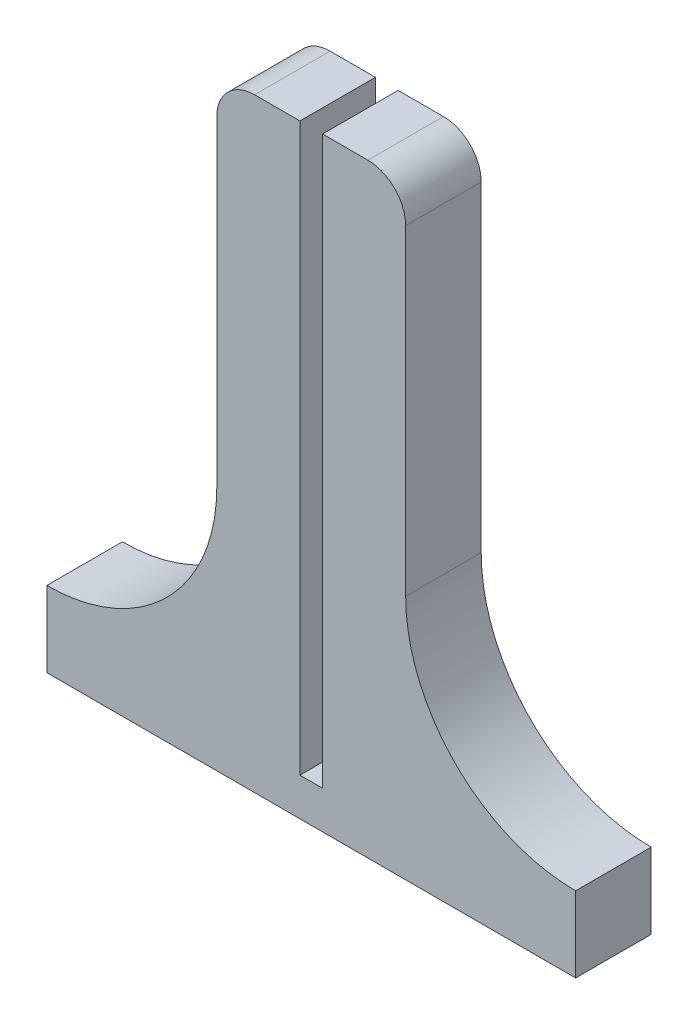
from build123d import *

# Parameters (mm, degrees)
BOSS_EXTRU_1_DEPTH      = 20
CONG_1_R                = 10
ESQUISSE2_W             = 6
ESQUISSE2_H             = 150
ENL_V_MAT_EXTRU_1_DEPTH = 20
ENL_V_MAT_EXTRU_2_DEPTH = 0.6


with BuildPart() as part:
    # Esquisse1 → Boss.-Extru.1 (new body)
    with BuildSketch(Plane.XY):
        with BuildLine():
            Line((-70, 0), (70, 0))
            Line((70, 0), (70, 20))
            ThreePointArc((70, 20), (38.180194847, 33.180194847), (25, 65))
            Line((25, 65), (25, 160))
            Line((25, 160), (-25, 160))
            Line((-25, 160), (-25, 65))
            ThreePointArc((-25, 65), (-38.180194847, 33.180194847), (-70, 20))
            Line((-70, 20), (-70, 0))
        make_face()
    extrude(amount=BOSS_EXTRU_1_DEPTH)

    # Congé1
    cong_1_edges = [part.edges().sort_by_distance(p)[0] for p in [
        (-25, 160, 10),
        (25, 160, 10),
    ]]
    fillet(cong_1_edges, radius=CONG_1_R)

    # Esquisse2 → Enlèv. mat.-Extru.1 (cut)
    with BuildSketch(Plane.XY.offset(20)):
        with Locations((0, 85)):
            Rectangle(ESQUISSE2_W, ESQUISSE2_H)
    extrude(amount=-ENL_V_MAT_EXTRU_1_DEPTH, mode=Mode.SUBTRACT)

    # Esquisse3 → Enlèv. mat.-Extru.2 (cut)
    # profile 1 of 8: a face of its own
    with BuildSketch(Plane.ZY.offset(25)):
        with BuildLine():
            add(Edge.make_bspline(
                [(10.298264208, 116.00253619), (10.269097337, 115.992326869), (10.217774636, 115.974362311), (10.146223156, 115.960911494), (10.087850074, 115.966864128), (10.042769968, 115.997389601), (10.018320339, 116.051964444), (10.004954592, 116.125720815), (10.002334597, 116.224587194), (10.000840513, 116.299040881), (10, 116.340925628)],
                knots=[0, 0, 0, 0, 1.205802245, 2.121757528, 2.825936218, 3.439242086, 4.14792585, 5.090303633, 6.363118044, 8, 8, 8, 8], degree=3))
            add(Edge.make_bspline(
                [(10, 116.340925628), (10.000114375, 116.382830885), (10.000317702, 116.45732656), (10.004773603, 116.556579531), (10.01453085, 116.631507153), (10.02464009, 116.687809902), (10.043786522, 116.728119067), (10.070404737, 116.755826472), (10.102576181, 116.775404191), (10.125641709, 116.786940542), (10.137763289, 116.793003217)],
                knots=[0, 0, 0, 0, 1.984758632, 3.528338574, 4.698935026, 5.564578638, 6.225528186, 6.778115051, 7.357865301, 8, 8, 8, 8], degree=3))
            Line((10.137763289, 116.793003217), (11.540808824, 117.293231081))
            Line((11.540808824, 117.293231081), (11.540808824, 119.722144991))
            Line((11.540808824, 119.722144991), (10.156488396, 120.200972733))
            add(Edge.make_bspline(
                [(10.156488396, 120.200972733), (10.143862376, 120.205976287), (10.119506065, 120.215628427), (10.085507972, 120.235820612), (10.058092353, 120.265723983), (10.033968103, 120.305141208), (10.017547599, 120.359621157), (10.005565685, 120.430956204), (10.002174093, 120.522853414), (10.00077614, 120.591090262), (10, 120.628975184)],
                knots=[0, 0, 0, 0, 0.663060064, 1.27908053, 1.910294906, 2.623277198, 3.518069493, 4.666729453, 6.149376829, 8, 8, 8, 8], degree=3))
            add(Edge.make_bspline(
                [(10, 120.628975184), (10.000510946, 120.66864451), (10.00143085, 120.740064936), (10.007654826, 120.836367622), (10.023164734, 120.908664456), (10.048583816, 120.962231124), (10.093140982, 120.990826296), (10.15073614, 120.995142921), (10.221785969, 120.982308262), (10.273109429, 120.964251351), (10.302276731, 120.953989545)],
                knots=[0, 0, 0, 0, 1.580415266, 2.845370517, 3.831421033, 4.522876749, 5.138370736, 5.836404331, 6.770420993, 8, 8, 8, 8], degree=3))
            Line((10.302276731, 120.953989545), (15.665682445, 118.995878332))
            add(Edge.make_bspline(
                [(15.665682445, 118.995878332), (15.680224312, 118.989272066), (15.708098977, 118.976608806), (15.745112383, 118.949084074), (15.773356627, 118.910133289), (15.792627136, 118.858485618), (15.806954153, 118.793229828), (15.815447144, 118.711183525), (15.820619559, 118.609856356), (15.820757428, 118.53533922), (15.820833333, 118.49431296)],
                knots=[0, 0, 0, 0, 0.683309499, 1.30980594, 1.951546434, 2.714075901, 3.654596571, 4.80831387, 6.242780742, 8, 8, 8, 8], degree=3))
            add(Edge.make_bspline(
                [(15.820833333, 118.49431296), (15.820751345, 118.450170997), (15.820603023, 118.370316023), (15.815545051, 118.261812307), (15.806709356, 118.174582224), (15.793508021, 118.105178335), (15.771516131, 118.051537529), (15.742893381, 118.010273306), (15.7043801, 117.981144433), (15.675352025, 117.968518025), (15.660332414, 117.961984911)],
                knots=[0, 0, 0, 0, 1.785583793, 3.230208585, 4.391350102, 5.332300968, 6.075914607, 6.721668301, 7.338569788, 8, 8, 8, 8], degree=3))
            Line((15.660332414, 117.961984911), (10.298264208, 116.00253619))
        make_face()
        Polygon((15.050428922, 118.51705059), (15.050428922, 118.521063113), (12.140012255, 119.52820638), (12.140012255, 117.496532246), align=None, mode=Mode.SUBTRACT)
    # profile 2 of 8: a face of its own
    with BuildSketch(Plane.ZY.offset(25)):
        with BuildLine():
            add(Edge.make_bspline(
                [(10.137763289, 114.305238971), (10.126952741, 114.306440051), (10.105807787, 114.308789312), (10.075590027, 114.322520282), (10.052152964, 114.34960007), (10.031346744, 114.386960575), (10.01867842, 114.439438389), (10.005169697, 114.506555801), (10.002316192, 114.59327153), (10.000826824, 114.657474067), (10, 114.693116192)],
                knots=[0, 0, 0, 0, 0.57799335, 1.130529403, 1.718684988, 2.452414818, 3.392179586, 4.57566491, 6.098975781, 8, 8, 8, 8], degree=3))
            add(Edge.make_bspline(
                [(10, 114.693116192), (10.000788929, 114.727430941), (10.002214206, 114.789423857), (10.005533098, 114.874244869), (10.018513727, 114.941543918), (10.031979891, 114.995265081), (10.050944416, 115.034754777), (10.075826673, 115.061160417), (10.105990396, 115.073434551), (10.12697314, 115.074893258), (10.137763289, 115.075643382)],
                knots=[0, 0, 0, 0, 1.843799585, 3.331002373, 4.54710588, 5.517086629, 6.298633703, 6.874127249, 7.421032119, 8, 8, 8, 8], degree=3))
            Line((10.137763289, 115.075643382), (14.142261221, 115.075643382))
            add(Edge.make_bspline(
                [(14.142261221, 115.075643382), (14.153100676, 115.074988992), (14.173768968, 115.073741223), (14.203196443, 115.060372601), (14.229274794, 115.035150123), (14.248947591, 114.995108055), (14.267208843, 114.942366519), (14.274209332, 114.873798524), (14.279977411, 114.789543787), (14.28000773, 114.727471176), (14.28002451, 114.693116192)],
                knots=[0, 0, 0, 0, 0.578058868, 1.102222245, 1.693953314, 2.485538118, 3.468049268, 4.674692977, 6.15956077, 8, 8, 8, 8], degree=3))
            add(Edge.make_bspline(
                [(14.28002451, 114.693116192), (14.279987354, 114.657430062), (14.279920417, 114.593141559), (14.274485048, 114.507027011), (14.267034375, 114.438605055), (14.249618683, 114.387078279), (14.22805071, 114.349271182), (14.203376024, 114.323332935), (14.173976891, 114.30846141), (14.153126405, 114.306342917), (14.142261221, 114.305238971)],
                knots=[0, 0, 0, 0, 1.897439217, 3.418233642, 4.592122555, 5.544614129, 6.288938217, 6.892652516, 7.422961471, 8, 8, 8, 8], degree=3))
            Line((14.142261221, 114.305238971), (10.137763289, 114.305238971))
        make_face()
    # profile 3 of 8: a face of its own
    with BuildSketch(Plane.ZY.offset(25)):
        with BuildLine():
            add(Edge.make_bspline(
                [(15.482443896, 114.904442402), (15.444864984, 114.90497412), (15.374947984, 114.905963402), (15.280152438, 114.925297195), (15.201582572, 114.951540877), (15.141020965, 114.995603849), (15.097897588, 115.056740729), (15.07119576, 115.13545123), (15.051978121, 115.230315707), (15.050970498, 115.300221823), (15.050428922, 115.337794884)],
                knots=[0, 0, 0, 0, 1.251063579, 2.327651597, 3.217401041, 3.99399053, 4.782598959, 5.672348403, 6.748936421, 8, 8, 8, 8], degree=3))
            add(Edge.make_bspline(
                [(15.050428922, 115.337794884), (15.051042843, 115.375350428), (15.052169349, 115.444262387), (15.07001531, 115.537842549), (15.095166142, 115.613961669), (15.135593008, 115.674019365), (15.195496519, 115.713766754), (15.270349855, 115.741646957), (15.363585716, 115.758385572), (15.431991775, 115.75972261), (15.469068819, 115.760447304)],
                knots=[0, 0, 0, 0, 1.282619219, 2.353522076, 3.246122122, 4.012069897, 4.778017671, 5.661712447, 6.732615304, 8, 8, 8, 8], degree=3))
            add(Edge.make_bspline(
                [(15.469068819, 115.760447304), (15.507481007, 115.759692066), (15.57853694, 115.758295007), (15.675854588, 115.741758824), (15.754269606, 115.713153879), (15.815387889, 115.671002169), (15.85937987, 115.611497135), (15.887461278, 115.534260122), (15.904379597, 115.439291858), (15.905712187, 115.369979507), (15.906433824, 115.332444853)],
                knots=[0, 0, 0, 0, 1.278224906, 2.364495922, 3.271623907, 4.037937767, 4.801080858, 5.694373703, 6.751436324, 8, 8, 8, 8], degree=3))
            add(Edge.make_bspline(
                [(15.906433824, 115.332444853), (15.905746572, 115.294903577), (15.904477479, 115.225578998), (15.887188017, 115.130845605), (15.86034961, 115.053432876), (15.818635727, 114.992794954), (15.758906922, 114.950494476), (15.68232171, 114.923479461), (15.588403853, 114.906519168), (15.519534335, 114.905169357), (15.482443896, 114.904442402)],
                knots=[0, 0, 0, 0, 1.267726145, 2.341012151, 3.242611919, 4.020686865, 4.786544989, 5.674045477, 6.747331483, 8, 8, 8, 8], degree=3))
        make_face()
    # profile 4 of 8: a face of its own
    with BuildSketch(Plane.ZY.offset(25)):
        with BuildLine():
            add(Edge.make_bspline(
                [(15.482443896, 113.449234069), (15.444864984, 113.449765787), (15.374947984, 113.450755069), (15.280152438, 113.470088862), (15.201582572, 113.496332543), (15.141020965, 113.540395515), (15.097897588, 113.601532395), (15.07119576, 113.680242896), (15.051978121, 113.775107374), (15.050970498, 113.845013489), (15.050428922, 113.88258655)],
                knots=[0, 0, 0, 0, 1.251063579, 2.327651597, 3.217401041, 3.99399053, 4.782598959, 5.672348403, 6.748936421, 8, 8, 8, 8], degree=3))
            add(Edge.make_bspline(
                [(15.050428922, 113.88258655), (15.051042843, 113.920142095), (15.052169349, 113.989054054), (15.07001531, 114.082634216), (15.095166142, 114.158753336), (15.135593008, 114.218811032), (15.195496519, 114.258558421), (15.270349855, 114.286438624), (15.363585716, 114.303177238), (15.431991775, 114.304514277), (15.469068819, 114.305238971)],
                knots=[0, 0, 0, 0, 1.282619219, 2.353522076, 3.246122122, 4.012069897, 4.778017671, 5.661712447, 6.732615304, 8, 8, 8, 8], degree=3))
            add(Edge.make_bspline(
                [(15.469068819, 114.305238971), (15.507480723, 114.304483612), (15.578536131, 114.303086328), (15.675857083, 114.286551557), (15.75426241, 114.257942471), (15.815410243, 114.21580339), (15.85904033, 114.156589791), (15.887356633, 114.08087932), (15.904497657, 113.987675081), (15.905750426, 113.919679053), (15.906433824, 113.88258655)],
                knots=[0, 0, 0, 0, 1.287529354, 2.381707548, 3.295438694, 4.067330701, 4.836028859, 5.721921549, 6.757285759, 8, 8, 8, 8], degree=3))
            add(Edge.make_bspline(
                [(15.906433824, 113.88258655), (15.905777513, 113.844148176), (15.904570951, 113.773483077), (15.887088424, 113.67705046), (15.86068409, 113.598539584), (15.818612961, 113.537595226), (15.758914017, 113.495283461), (15.682319241, 113.468272061), (15.588404648, 113.451310534), (15.519534614, 113.449960919), (15.482443896, 113.449234069)],
                knots=[0, 0, 0, 0, 1.288329615, 2.368464882, 3.27748285, 4.049854626, 4.810099126, 5.69109437, 6.756513352, 8, 8, 8, 8], degree=3))
        make_face()
    # profile 5 of 8: a face of its own
    with BuildSketch(Plane.ZY.offset(25)):
        with BuildLine():
            add(Edge.make_bspline(
                [(12.295163143, 109.426011029), (12.267907447, 109.426947638), (12.216857846, 109.428701896), (12.145758019, 109.443741511), (12.088029732, 109.472661135), (12.042032764, 109.510528174), (12.011185902, 109.557494869), (11.985689828, 109.60534849), (11.972530905, 109.657632034), (11.970060534, 109.693009755), (11.968811275, 109.710900161)],
                knots=[0, 0, 0, 0, 1.335857227, 2.502045011, 3.528175974, 4.473906449, 5.383343072, 6.262883897, 7.121545699, 8, 8, 8, 8], degree=3))
            Line((11.968811275, 109.710900161), (11.968811275, 112.336427696))
            add(Edge.make_bspline(
                [(11.968811275, 112.336427696), (11.914399597, 112.335675361), (11.808556941, 112.334211905), (11.653481631, 112.322310073), (11.507008251, 112.300871807), (11.368645965, 112.271985648), (11.239466638, 112.233398202), (11.119292521, 112.184116643), (11.009201712, 112.122029714), (10.908363832, 112.049779916), (10.817107913, 111.966109096), (10.738576645, 111.869012352), (10.669739472, 111.760988947), (10.611688096, 111.641502327), (10.567739016, 111.508291514), (10.535853566, 111.362218198), (10.517464709, 111.202241204), (10.514921785, 111.091255885), (10.513602941, 111.033695236)],
                knots=[0, 0, 0, 0, 1.162947511, 2.262188155, 3.321461316, 4.325137283, 5.28079692, 6.199292087, 7.095265559, 7.975956197, 8.845856955, 9.73291758, 10.637013272, 11.578938221, 12.564352389, 13.627946076, 14.769774549, 16, 16, 16, 16], degree=3))
            add(Edge.make_bspline(
                [(10.513602941, 111.033695236), (10.513800845, 110.987296925), (10.514183925, 110.897484363), (10.526135339, 110.766802361), (10.541089055, 110.643807458), (10.571341734, 110.494681598), (10.617109769, 110.327080018), (10.679127929, 110.149631539), (10.743769883, 110.003142849), (10.796377529, 109.884546936), (10.844080672, 109.795758508), (10.852556206, 109.740196061), (10.856004902, 109.717587699)],
                knots=[0, 0, 0, 0, 1.01347145, 1.961762513, 2.865722105, 3.719843941, 5.284486502, 6.658853132, 7.824326974, 8.779052951, 9.503196596, 10, 10, 10, 10], degree=3))
            add(Edge.make_bspline(
                [(10.856004902, 109.717587699), (10.85525752, 109.707644375), (10.853771909, 109.687879486), (10.841206037, 109.660963629), (10.821469304, 109.637618619), (10.791286215, 109.622066765), (10.752471041, 109.609904542), (10.702367706, 109.603044318), (10.640357119, 109.59729763), (10.594767264, 109.597242324), (10.569778263, 109.59721201)],
                knots=[0, 0, 0, 0, 0.686729454, 1.365049659, 2.022603672, 2.770670072, 3.680311579, 4.839623702, 6.267714482, 8, 8, 8, 8], degree=3))
            add(Edge.make_bspline(
                [(10.569778263, 109.59721201), (10.551946828, 109.597591463), (10.518492316, 109.598303375), (10.47152045, 109.600285917), (10.430548176, 109.606216175), (10.394179233, 109.612436835), (10.36157064, 109.621504073), (10.331991032, 109.635324997), (10.306175037, 109.654828734), (10.282092858, 109.672925032), (10.263408262, 109.697957154), (10.244853866, 109.729608512), (10.22161801, 109.773336712), (10.178353861, 109.851181111), (10.127168962, 109.976012971), (10.065204935, 110.152307677), (10.009219881, 110.363008798), (9.958570297, 110.602729633), (9.920487255, 110.866695606), (9.91646252, 111.050495646), (9.91439951, 111.144708372)],
                knots=[0, 0, 0, 0, 0.523723728, 0.982586185, 1.378731315, 1.738143054, 2.065368142, 2.369810598, 2.689353897, 3.014478, 3.247521083, 3.599953288, 4.091967521, 4.700993102, 6.213438645, 8.043092203, 10.186374065, 12.607132101, 15.235709053, 18, 18, 18, 18], degree=3))
            add(Edge.make_bspline(
                [(9.91439951, 111.144708372), (9.91638233, 111.226347584), (9.92023875, 111.385129062), (9.944655805, 111.615454988), (9.989788218, 111.82949561), (10.048389302, 112.028955847), (10.12911499, 112.21185356), (10.222624563, 112.381602309), (10.337368019, 112.53369645), (10.465595834, 112.672861088), (10.612864486, 112.795181561), (10.777303394, 112.901331926), (10.959182186, 112.991053501), (11.158305419, 113.064462021), (11.374658359, 113.121723471), (11.608227466, 113.16246028), (11.858544913, 113.188537691), (12.031160515, 113.191109648), (12.11994964, 113.192432598)],
                knots=[0, 0, 0, 0, 1.138312715, 2.213923543, 3.223288148, 4.184801417, 5.106262952, 6.005227789, 6.880412264, 7.755596738, 8.638188383, 9.541611846, 10.478396608, 11.459795211, 12.495607232, 13.594177056, 14.762505165, 16, 16, 16, 16], degree=3))
            add(Edge.make_bspline(
                [(12.11994964, 113.192432598), (12.204727247, 113.191081829), (12.37022644, 113.188444915), (12.612156171, 113.162334556), (12.840943919, 113.120411618), (13.056162214, 113.059923826), (13.256361416, 112.983622524), (13.443411775, 112.894433583), (13.612747004, 112.787093882), (13.767028533, 112.666129303), (13.903758047, 112.530121507), (14.025498183, 112.381082084), (14.128228477, 112.217097921), (14.214099247, 112.0408566), (14.282949083, 111.853302294), (14.330244129, 111.653935337), (14.360943881, 111.444373846), (14.364043412, 111.300862803), (14.365625, 111.227633847)],
                knots=[0, 0, 0, 0, 1.206949826, 2.356155476, 3.460715998, 4.516002349, 5.534826805, 6.508824267, 7.461818199, 8.384005709, 9.295398287, 10.202712429, 11.118693544, 12.044393332, 12.990424503, 13.957506214, 14.957782715, 16, 16, 16, 16], degree=3))
            add(Edge.make_bspline(
                [(14.365625, 111.227633847), (14.36413248, 111.149942936), (14.361255734, 111.000198224), (14.330750997, 110.784800258), (14.284335776, 110.586701434), (14.214390198, 110.407787782), (14.131479226, 110.244328144), (14.033546255, 110.097075415), (13.922618452, 109.963993944), (13.798329619, 109.846265723), (13.660853272, 109.744369144), (13.512322767, 109.656821694), (13.352867777, 109.583223786), (13.18254065, 109.524345579), (13.003504556, 109.481518154), (12.818225456, 109.44875662), (12.626799801, 109.430159793), (12.497164695, 109.427404693), (12.431588925, 109.426011029)],
                knots=[0, 0, 0, 0, 1.242451977, 2.394753943, 3.474556508, 4.490852541, 5.460890958, 6.402814045, 7.31450092, 8.228000656, 9.135546277, 10.047149394, 10.982483155, 11.941438071, 12.926060434, 13.925435957, 14.95058415, 16, 16, 16, 16], degree=3))
            Line((12.431588925, 109.426011029), (12.295163143, 109.426011029))
        make_face()
        with BuildLine():
            add(Edge.make_bspline(
                [(12.482414216, 110.196415441), (12.531018437, 110.196304615), (12.625655426, 110.196088825), (12.763857224, 110.205028113), (12.894201906, 110.224340943), (13.01680672, 110.249670581), (13.130470878, 110.287036267), (13.236778829, 110.33035765), (13.334490566, 110.384510528), (13.425075572, 110.445615915), (13.504882091, 110.516765197), (13.575998123, 110.594940329), (13.634821343, 110.682615941), (13.682924577, 110.777981399), (13.721041532, 110.881102693), (13.747051665, 110.992072512), (13.763688977, 111.111215197), (13.765490234, 111.193245426), (13.766421569, 111.235658892)],
                knots=[0, 0, 0, 0, 1.23774357, 2.410003075, 3.522847847, 4.591904643, 5.593783504, 6.565943827, 7.511138326, 8.433969626, 9.343005538, 10.227527643, 11.118802201, 12.022717545, 12.942399837, 13.911837482, 14.92032228, 16, 16, 16, 16], degree=3))
            add(Edge.make_bspline(
                [(13.766421569, 111.235658892), (13.765198304, 111.27898316), (13.762813496, 111.363445694), (13.742546762, 111.485696501), (13.70876393, 111.599777618), (13.662171493, 111.705331458), (13.603182488, 111.801778684), (13.539042617, 111.892291699), (13.462134345, 111.971266878), (13.379437206, 112.043993531), (13.287924301, 112.108512814), (13.188323525, 112.164022393), (13.082645531, 112.214757632), (12.93017424, 112.266353778), (12.730771119, 112.318950187), (12.565736164, 112.330564118), (12.482414216, 112.336427696)],
                knots=[0, 0, 0, 0, 0.964495249, 1.880325208, 2.750609288, 3.608626796, 4.441391799, 5.265647136, 6.073407844, 6.889850158, 7.716375352, 8.561306733, 9.427559201, 10.322643299, 12.143396204, 14, 14, 14, 14], degree=3))
            Line((12.482414216, 112.336427696), (12.482414216, 110.196415441))
        make_face(mode=Mode.SUBTRACT)
    # profile 6 of 8: a face of its own
    with BuildSketch(Plane.ZY.offset(25)):
        with BuildLine():
            add(Edge.make_bspline(
                [(10.345076976, 103.177175245), (10.317000076, 103.177956538), (10.26524768, 103.179396647), (10.193775132, 103.182931754), (10.134591551, 103.195525879), (10.085769193, 103.212028557), (10.047624521, 103.234975624), (10.01854723, 103.261914966), (10.003103851, 103.296652865), (10.001058104, 103.321046651), (10, 103.333663641)],
                knots=[0, 0, 0, 0, 1.605313513, 2.958974165, 4.077843145, 5.052651833, 5.886909949, 6.607263286, 7.279646663, 8, 8, 8, 8], degree=3))
            Line((10, 103.333663641), (10, 105.886965763))
            add(Edge.make_bspline(
                [(10, 105.886965763), (10.003536552, 105.92100722), (10.010796097, 105.990884735), (10.05650501, 106.070315548), (10.110312551, 106.124438375), (10.167185469, 106.153632745), (10.236145728, 106.171130851), (10.286104631, 106.172471361), (10.312976792, 106.173192402)],
                knots=[0, 0, 0, 0, 1.276746539, 2.620800728, 3.344384187, 4.124832945, 4.991375171, 6, 6, 6, 6], degree=3))
            Line((10.312976792, 106.173192402), (15.677720014, 106.173192402))
            add(Edge.make_bspline(
                [(15.677720014, 106.173192402), (15.689023202, 106.17209402), (15.711307587, 106.169928546), (15.742781873, 106.154303145), (15.768860774, 106.124764877), (15.784104611, 106.078986859), (15.79899446, 106.019613199), (15.809880164, 105.943369105), (15.820346784, 105.85023515), (15.820661732, 105.782238359), (15.820833333, 105.745189951)],
                knots=[0, 0, 0, 0, 0.55219088, 1.088651567, 1.675504795, 2.428826423, 3.418011055, 4.676595417, 6.189225567, 8, 8, 8, 8], degree=3))
            add(Edge.make_bspline(
                [(15.820833333, 105.745189951), (15.820642524, 105.707256606), (15.820293837, 105.637936914), (15.810280107, 105.544260201), (15.798759146, 105.469062327), (15.784401262, 105.411174422), (15.768039609, 105.366641961), (15.743291519, 105.336067331), (15.711257974, 105.320491248), (15.689006506, 105.318299307), (15.677720014, 105.3171875)],
                knots=[0, 0, 0, 0, 1.855003094, 3.389847137, 4.605770636, 5.574134644, 6.307541132, 6.910984118, 7.447624331, 8, 8, 8, 8], degree=3))
            Line((15.677720014, 105.3171875), (10.684803922, 105.3171875))
            Line((10.684803922, 105.3171875), (10.684803922, 103.326976103))
            add(Edge.make_bspline(
                [(10.684803922, 103.326976103), (10.683906626, 103.314703221), (10.682156495, 103.290765577), (10.664462281, 103.259065487), (10.638945237, 103.232111236), (10.602922544, 103.210734794), (10.55551668, 103.195231414), (10.496790857, 103.183056829), (10.42491444, 103.179362967), (10.373156749, 103.177944692), (10.345076976, 103.177175245)],
                knots=[0, 0, 0, 0, 0.711060461, 1.386888063, 2.068714254, 2.864024082, 3.803314885, 4.97330271, 6.357945089, 8, 8, 8, 8], degree=3))
        make_face()
    # profile 7 of 8: a face of its own
    with BuildSketch(Plane.ZY.offset(25)):
        with BuildLine():
            add(Edge.make_bspline(
                [(10.133750766, 99.325153186), (10.117499868, 99.326553216), (10.086383753, 99.329233897), (10.049341677, 99.362577538), (10.028311647, 99.410039503), (10.00951912, 99.471876554), (10.002560398, 99.556885748), (10.000934697, 99.621209577), (10, 99.658192593)],
                knots=[0, 0, 0, 0, 0.724001117, 1.386268131, 2.139240658, 3.069878209, 4.315325055, 6, 6, 6, 6], degree=3))
            add(Edge.make_bspline(
                [(10, 99.658192593), (10.000909497, 99.695183669), (10.00251313, 99.760406658), (10.009972006, 99.847514115), (10.027422764, 99.911366001), (10.049025137, 99.960014596), (10.08840417, 99.98930887), (10.1190282, 99.991447797), (10.135088274, 99.992569508)],
                knots=[0, 0, 0, 0, 1.665775782, 2.937110524, 3.915160111, 4.641913912, 5.287782743, 6, 6, 6, 6], degree=3))
            Line((10.135088274, 99.992569508), (10.541690602, 99.992569508))
            add(Edge.make_bspline(
                [(10.541690602, 99.992569508), (10.495897809, 100.036864691), (10.405072698, 100.124719452), (10.283271821, 100.268410027), (10.176159904, 100.419853721), (10.083267964, 100.577692324), (10.007380833, 100.742027054), (9.954065325, 100.912838845), (9.920375564, 101.088446581), (9.916401679, 101.207321408), (9.91439951, 101.267214308)],
                knots=[0, 0, 0, 0, 1.04528672, 2.073214502, 3.086422922, 4.086758263, 5.075786975, 6.050195739, 7.017626916, 8, 8, 8, 8], degree=3))
            add(Edge.make_bspline(
                [(9.91439951, 101.267214308), (9.915360016, 101.318979135), (9.917244433, 101.42053657), (9.933916385, 101.568434669), (9.958770938, 101.709057671), (9.995249389, 101.841306575), (10.039927583, 101.96633699), (10.09645303, 102.081049106), (10.160842186, 102.186722498), (10.234936635, 102.282172152), (10.317844947, 102.36849119), (10.411146874, 102.443202853), (10.51180144, 102.509751141), (10.622090958, 102.564181662), (10.740593243, 102.6089689), (10.867562616, 102.640722636), (11.002563505, 102.659637652), (11.094911125, 102.662239219), (11.142231541, 102.663572304)],
                knots=[0, 0, 0, 0, 1.182508077, 2.319963066, 3.397049868, 4.442497454, 5.451313259, 6.426383306, 7.359459888, 8.274451657, 9.182268696, 10.087624203, 11.000344391, 11.934366029, 12.89187355, 13.890139628, 14.918873387, 16, 16, 16, 16], degree=3))
            add(Edge.make_bspline(
                [(11.142231541, 102.663572304), (11.197204299, 102.66238753), (11.304283877, 102.660079749), (11.458546266, 102.631913965), (11.602736212, 102.59017851), (11.734051929, 102.527179742), (11.856033261, 102.450861886), (11.966095099, 102.3574877), (12.065692549, 102.249638577), (12.154393656, 102.126946676), (12.23163765, 101.989188214), (12.300525564, 101.837909522), (12.355589863, 101.670679666), (12.402482611, 101.490698724), (12.437835007, 101.297031902), (12.465038532, 101.091776165), (12.479053921, 100.874183248), (12.481274858, 100.72554055), (12.482414216, 100.649285769)],
                knots=[0, 0, 0, 0, 0.965443146, 1.880554095, 2.748616068, 3.597345577, 4.432533671, 5.272711072, 6.12707045, 7.008377997, 7.928278645, 8.900225302, 9.92661174, 11.019977072, 12.168582707, 13.38605233, 14.659025893, 16, 16, 16, 16], degree=3))
            Line((12.482414216, 100.649285769), (12.482414216, 100.095557598))
            Line((12.482414216, 100.095557598), (12.800741039, 100.095557598))
            add(Edge.make_bspline(
                [(12.800741039, 100.095557598), (12.875415585, 100.097319938), (13.016467878, 100.10064881), (13.18557477, 100.134073572), (13.30698104, 100.170050909), (13.385927587, 100.20939981), (13.459778752, 100.251134174), (13.524264189, 100.304094664), (13.580349059, 100.365088831), (13.631293901, 100.432366258), (13.671574311, 100.509328771), (13.707834303, 100.593370663), (13.73327889, 100.68762342), (13.754253241, 100.791128017), (13.763786637, 100.905021202), (13.765521508, 100.984099258), (13.766421569, 101.025125421)],
                knots=[0, 0, 0, 0, 2.019084218, 3.813835772, 4.650002842, 5.438441153, 6.196244138, 6.942905917, 7.686045687, 8.436989712, 9.220327809, 10.03199393, 10.910907431, 11.857988045, 12.888711541, 14, 14, 14, 14], degree=3))
            add(Edge.make_bspline(
                [(13.766421569, 101.025125421), (13.765663343, 101.069734641), (13.764181904, 101.156893229), (13.752271143, 101.284380474), (13.731177843, 101.404733502), (13.691436583, 101.5514648), (13.636050132, 101.718685705), (13.556696724, 101.895835407), (13.482431302, 102.047645139), (13.419526462, 102.154560643), (13.376117406, 102.226595203), (13.357235982, 102.272590708), (13.34124856, 102.309889731), (13.339281268, 102.333542384), (13.338419118, 102.343907973)],
                knots=[0, 0, 0, 0, 1.143534929, 2.234266574, 3.279115031, 4.271636165, 6.129528302, 7.788011536, 9.244858549, 10.458453731, 10.970266691, 11.395033847, 11.734878329, 12, 12, 12, 12], degree=3))
            add(Edge.make_bspline(
                [(13.338419118, 102.343907973), (13.339605797, 102.35517395), (13.341925165, 102.377193338), (13.355925818, 102.408754956), (13.381429227, 102.433958361), (13.4154436, 102.456133285), (13.459009408, 102.474980387), (13.5138067, 102.483905141), (13.57586596, 102.490807356), (13.620159541, 102.491833559), (13.643370864, 102.492371324)],
                knots=[0, 0, 0, 0, 0.722226339, 1.411593723, 2.158196488, 2.981018633, 4.003595283, 5.16724152, 6.515539527, 8, 8, 8, 8], degree=3))
            add(Edge.make_bspline(
                [(13.643370864, 102.492371324), (13.678619999, 102.491700383), (13.741361652, 102.490506142), (13.828157635, 102.480045087), (13.903493282, 102.452401165), (13.954888143, 102.407163992), (13.997022102, 102.361116258), (14.027831305, 102.31151224), (14.063206547, 102.253464592), (14.109997414, 102.15664055), (14.17015264, 102.019646647), (14.22961154, 101.834543825), (14.285331192, 101.630530488), (14.327554847, 101.409672397), (14.361223841, 101.179035744), (14.364156208, 101.022129933), (14.365625, 100.943537454)],
                knots=[0, 0, 0, 0, 0.789429819, 1.405144594, 1.952168764, 2.555698058, 2.916425161, 3.348467631, 3.858808214, 4.439347839, 5.754453571, 7.207004439, 8.788703472, 10.48854221, 12.241147528, 14, 14, 14, 14], degree=3))
            add(Edge.make_bspline(
                [(14.365625, 100.943537454), (14.364124889, 100.872628844), (14.361233157, 100.735939879), (14.345286742, 100.538465714), (14.312473984, 100.358059004), (14.27063192, 100.193377129), (14.215342529, 100.045225642), (14.149635664, 99.911308844), (14.072622803, 99.791284188), (13.98135944, 99.687678056), (13.880843409, 99.596355169), (13.766052947, 99.521766878), (13.642201895, 99.456678172), (13.505066787, 99.407655671), (13.357541989, 99.370718206), (13.1983325, 99.344048681), (13.027555782, 99.328038598), (12.909560532, 99.326132987), (12.848891314, 99.325153186)],
                knots=[0, 0, 0, 0, 1.327310201, 2.558626637, 3.702692837, 4.755062866, 5.734555212, 6.65622678, 7.54258946, 8.394223195, 9.23333949, 10.075685238, 10.948912375, 11.846397708, 12.79347634, 13.79207927, 14.864760873, 16, 16, 16, 16], degree=3))
            Line((12.848891314, 99.325153186), (10.133750766, 99.325153186))
        make_face()
        with BuildLine():
            Line((11.968811275, 100.095557598), (11.968811275, 100.720173675))
            add(Edge.make_bspline(
                [(11.968811275, 100.720173675), (11.968615955, 100.768799729), (11.968239116, 100.862616467), (11.956412711, 100.998215786), (11.941498208, 101.12390065), (11.918280216, 101.239471808), (11.890531357, 101.346070197), (11.8563154, 101.443481175), (11.814772465, 101.531495295), (11.766172214, 101.608773592), (11.714174134, 101.678521548), (11.655280176, 101.737047841), (11.591580081, 101.786366968), (11.522630461, 101.824722362), (11.449539645, 101.856805981), (11.37044205, 101.87700566), (11.286323775, 101.891539898), (11.228347295, 101.892613473), (11.198406863, 101.893167892)],
                knots=[0, 0, 0, 0, 1.470403632, 2.836925074, 4.115055408, 5.297440403, 6.39996988, 7.445155629, 8.416455274, 9.337180267, 10.20312658, 11.042402279, 11.840913429, 12.63221569, 13.42386272, 14.248377648, 15.095420588, 16, 16, 16, 16], degree=3))
            add(Edge.make_bspline(
                [(11.198406863, 101.893167892), (11.148627944, 101.891240026), (11.052860972, 101.887531109), (10.917439681, 101.848228123), (10.796690262, 101.786846826), (10.69561774, 101.697490332), (10.612577254, 101.588543766), (10.554902264, 101.457500265), (10.519804812, 101.307830975), (10.515740108, 101.201440025), (10.513602941, 101.145501111)],
                knots=[0, 0, 0, 0, 1.039784666, 2.000385537, 2.92750565, 3.854155501, 4.800907748, 5.774533853, 6.829880164, 8, 8, 8, 8], degree=3))
            add(Edge.make_bspline(
                [(10.513602941, 101.145501111), (10.515324173, 101.09808946), (10.518732747, 101.004199633), (10.548407748, 100.866702553), (10.593677872, 100.734166681), (10.659601984, 100.606231525), (10.746077428, 100.481346315), (10.849606636, 100.353716995), (10.973603041, 100.223754867), (11.065895166, 100.139568673), (11.11414388, 100.095557598)],
                knots=[0, 0, 0, 0, 0.909503217, 1.801099472, 2.689194817, 3.592836078, 4.554556236, 5.601521194, 6.746117092, 8, 8, 8, 8], degree=3))
            Line((11.11414388, 100.095557598), (11.968811275, 100.095557598))
        make_face(mode=Mode.SUBTRACT)
    # profile 8 of 8: a face of its own
    with BuildSketch(Plane.ZY.offset(25)):
        with BuildLine():
            add(Edge.make_bspline(
                [(12.192175054, 94.189123775), (12.106504526, 94.190024141), (11.939299627, 94.191781405), (11.695235445, 94.21663076), (11.463666633, 94.249093255), (11.246574435, 94.300681092), (11.043904911, 94.364650584), (10.85551554, 94.441387981), (10.684040946, 94.534953727), (10.525776369, 94.638165055), (10.386650046, 94.758710546), (10.262336746, 94.889392984), (10.157217146, 95.034716803), (10.068653779, 95.191423889), (9.99762687, 95.361212693), (9.951673147, 95.544406535), (9.918480966, 95.738099955), (9.915782065, 95.871556187), (9.91439951, 95.939921301)],
                knots=[0, 0, 0, 0, 1.266589352, 2.472028043, 3.625703313, 4.723023035, 5.767905653, 6.767240796, 7.726180359, 8.65348765, 9.556175132, 10.442601023, 11.315804603, 12.201666118, 13.100563771, 14.028316483, 14.989973235, 16, 16, 16, 16], degree=3))
            add(Edge.make_bspline(
                [(9.91439951, 95.939921301), (9.9160724, 96.002444642), (9.919293303, 96.122824129), (9.947834305, 96.298878511), (9.999334678, 96.465323305), (10.074754576, 96.626493986), (10.172321736, 96.785222697), (10.293835253, 96.944606192), (10.439994473, 97.108704291), (10.549493716, 97.216552305), (10.607228477, 97.273416437)],
                knots=[0, 0, 0, 0, 0.966379089, 1.860620617, 2.748140033, 3.651924143, 4.604906618, 5.62385767, 6.747151057, 8, 8, 8, 8], degree=3))
            Line((10.607228477, 97.273416437), (10.133750766, 97.273416437))
            add(Edge.make_bspline(
                [(10.133750766, 97.273416437), (10.122960538, 97.274683792), (10.101453237, 97.277209911), (10.070589317, 97.290315299), (10.046513764, 97.317199727), (10.029795048, 97.355089748), (10.017644381, 97.403144742), (10.005860277, 97.462393319), (10.002127636, 97.535538203), (10.000754468, 97.589077162), (10, 97.618493413)],
                knots=[0, 0, 0, 0, 0.639235618, 1.274137385, 1.924611995, 2.711908422, 3.693527118, 4.842626516, 6.265224193, 8, 8, 8, 8], degree=3))
            add(Edge.make_bspline(
                [(10, 97.618493413), (10.000701821, 97.647480449), (10.001988015, 97.700603576), (10.006413978, 97.773992284), (10.016516995, 97.834332911), (10.031719659, 97.88207877), (10.047858249, 97.920049973), (10.075389309, 97.942519551), (10.106222718, 97.953063794), (10.127878484, 97.954698313), (10.139100797, 97.955545343)],
                knots=[0, 0, 0, 0, 1.711305005, 3.136225263, 4.338982, 5.304434936, 6.104784006, 6.721371554, 7.337397291, 8, 8, 8, 8], degree=3))
            Line((10.139100797, 97.955545343), (16.105722465, 97.955545343))
            add(Edge.make_bspline(
                [(16.105722465, 97.955545343), (16.11696024, 97.954795268), (16.13880666, 97.953337109), (16.170134614, 97.94111261), (16.19676647, 97.915228326), (16.215031061, 97.874836456), (16.231340658, 97.821918011), (16.240773574, 97.753835535), (16.247498188, 97.669462522), (16.248359354, 97.607370107), (16.248835784, 97.573018153)],
                knots=[0, 0, 0, 0, 0.59768484, 1.161909203, 1.749612123, 2.524620174, 3.493198463, 4.695149072, 6.171627058, 8, 8, 8, 8], degree=3))
            add(Edge.make_bspline(
                [(16.248835784, 97.573018153), (16.248333718, 97.537336755), (16.2474289, 97.473032203), (16.241109562, 97.386780618), (16.231165352, 97.318861476), (16.215691421, 97.267182811), (16.195544646, 97.228968727), (16.1703775, 97.202358281), (16.138980193, 97.188687451), (16.116979087, 97.186341309), (16.105722465, 97.185140931)],
                knots=[0, 0, 0, 0, 1.885462615, 3.397956304, 4.567726967, 5.50662302, 6.234346606, 6.83410974, 7.403485124, 8, 8, 8, 8], degree=3))
            Line((16.105722465, 97.185140931), (13.699546186, 97.185140931))
            add(Edge.make_bspline(
                [(13.699546186, 97.185140931), (13.757170621, 97.126770918), (13.866915238, 97.015606362), (14.008631861, 96.841748028), (14.123170808, 96.671970515), (14.215595437, 96.506842061), (14.285414026, 96.342869339), (14.332595874, 96.177975241), (14.360311838, 96.008190089), (14.36382405, 95.893214176), (14.365625, 95.834258195)],
                knots=[0, 0, 0, 0, 1.269587052, 2.417903831, 3.467214079, 4.437511901, 5.344042243, 6.22028172, 7.087417234, 8, 8, 8, 8], degree=3))
            add(Edge.make_bspline(
                [(14.365625, 95.834258195), (14.363813231, 95.763228349), (14.360293306, 95.625230756), (14.326231114, 95.426624907), (14.271431967, 95.243517163), (14.194903369, 95.076697453), (14.09867956, 94.926478535), (13.988574504, 94.789764333), (13.861865963, 94.668890249), (13.720250817, 94.563177997), (13.566238483, 94.47050223), (13.398510721, 94.393117995), (13.21884135, 94.327225899), (13.02709211, 94.275934829), (12.826601143, 94.237991231), (12.619905965, 94.209924945), (12.40783776, 94.191813379), (12.264437024, 94.190024979), (12.192175054, 94.189123775)],
                knots=[0, 0, 0, 0, 1.105679789, 2.148127262, 3.128012518, 4.075844512, 4.996833441, 5.900373812, 6.804207752, 7.716804868, 8.648235503, 9.598989186, 10.589912649, 11.626048107, 12.687115461, 13.76657091, 14.874538653, 16, 16, 16, 16], degree=3))
        make_face()
        with BuildLine():
            add(Edge.make_bspline(
                [(12.105237056, 95.045128676), (12.210067441, 95.047747441), (12.416697144, 95.05290925), (12.671956552, 95.079442336), (12.86732836, 95.116689952), (13.005101204, 95.152481366), (13.133937696, 95.196605239), (13.253825938, 95.248571044), (13.363934073, 95.309959319), (13.463112854, 95.380833255), (13.55155403, 95.460748931), (13.628471581, 95.550200201), (13.690858142, 95.65132908), (13.735793624, 95.764289049), (13.76082613, 95.889345396), (13.764510485, 95.976369602), (13.766421569, 96.021509268)],
                knots=[0, 0, 0, 0, 2.041182811, 4.023346833, 4.986812803, 5.911008632, 6.792097625, 7.635486321, 8.451545981, 9.241573163, 10.003494753, 10.766996685, 11.530646607, 12.305898425, 13.121265434, 14, 14, 14, 14], degree=3))
            add(Edge.make_bspline(
                [(13.766421569, 96.021509268), (13.764339468, 96.067616938), (13.760145534, 96.160490701), (13.725980264, 96.299523663), (13.669520737, 96.43997364), (13.580584932, 96.579756398), (13.465714573, 96.723076082), (13.34953029, 96.842830871), (13.241284675, 96.941431188), (13.149601331, 97.022138568), (13.045946906, 97.103534338), (12.972550875, 97.157274364), (12.934491805, 97.185140931)],
                knots=[0, 0, 0, 0, 0.93025913, 1.873802477, 2.875411419, 3.974995982, 5.205489595, 6.581031719, 7.339392153, 8.162752217, 9.047306202, 10, 10, 10, 10], degree=3))
            Line((12.934491805, 97.185140931), (11.318782552, 97.185140931))
            add(Edge.make_bspline(
                [(11.318782552, 97.185140931), (11.256763374, 97.136710881), (11.137979821, 97.043954196), (10.975305507, 96.901169232), (10.836790624, 96.760267382), (10.720329975, 96.623026183), (10.627583067, 96.484951415), (10.563201053, 96.343543563), (10.521495907, 96.199072114), (10.516230428, 96.101140203), (10.513602941, 96.052271944)],
                knots=[0, 0, 0, 0, 1.311960167, 2.512759654, 3.60621705, 4.603756356, 5.511001283, 6.369287697, 7.186270636, 8, 8, 8, 8], degree=3))
            add(Edge.make_bspline(
                [(10.513602941, 96.052271944), (10.514755542, 96.008407452), (10.516990447, 95.923353693), (10.545464941, 95.801414402), (10.587767744, 95.688492445), (10.649292413, 95.586384867), (10.724162648, 95.493667589), (10.813083213, 95.412720075), (10.908774891, 95.336021693), (11.018445965, 95.272975668), (11.135814091, 95.217209342), (11.260687821, 95.168264473), (11.393225651, 95.13075838), (11.57776391, 95.087377675), (11.815974696, 95.052857832), (12.008816613, 95.047705053), (12.105237056, 95.045128676)],
                knots=[0, 0, 0, 0, 0.87571763, 1.698026622, 2.491433861, 3.279206178, 4.071810881, 4.866870794, 5.680426395, 6.520205271, 7.389906658, 8.279369827, 9.199474431, 10.142760825, 12.071390725, 14, 14, 14, 14], degree=3))
        make_face(mode=Mode.SUBTRACT)
    extrude(amount=-ENL_V_MAT_EXTRU_2_DEPTH, mode=Mode.SUBTRACT)


solid = part.part
